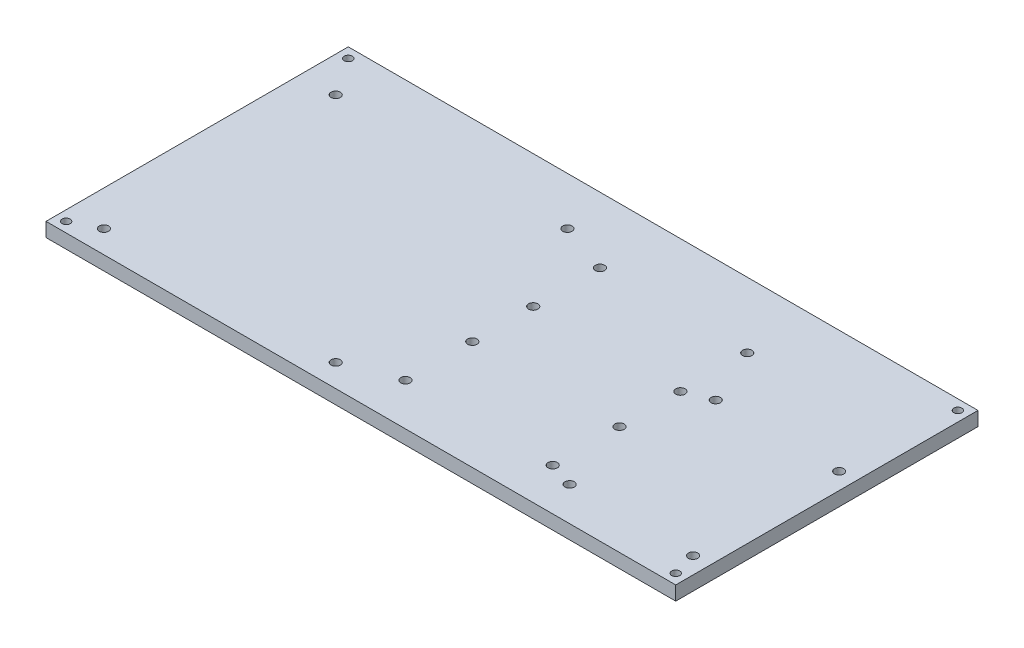
from build123d import *

# Parameters (mm, degrees)
SKETCH1_W                       = 250
SKETCH1_H                       = 120
BOSS_EXTRUDE1_DEPTH             = 5.588
F_3_0MM_CLEARANCE_DOWEL_HOLE2_D = 3.7
SKETCH6_R                       = 1.6
CUT_EXTRUDE1_DEPTH              = 139.766803465


with BuildPart() as part:
    # Sketch1 → Boss-Extrude1 (new body)
    with BuildSketch(Plane(origin=(0, 0, 0), x_dir=(1, 0, 0), z_dir=(0, 1, 0))):
        Rectangle(SKETCH1_W, SKETCH1_H)
    extrude(amount=BOSS_EXTRUDE1_DEPTH)

    # Ø3.0mm Clearance Dowel Hole2 (through all)
    with Locations(Plane(origin=(-44.960960081, 0, -163.688232646), x_dir=(-1, 0, 0), z_dir=(0, -1, 0))):
        with Locations((-45.935960081, -156.248232646), (-25.960960081, -122.688232646), (-45.935960081, -129.728232646), (-45.935960081, -180.428232646), (-45.935960081, -206.948232646), (-25.960960081, -214.688232646), (66.039039919, -214.688232646), (-104.385960081, -206.948232646), (-104.385960081, -180.428232646), (-104.385960081, -156.248232646), (-104.385960081, -129.728232646), (-163.338823355, -210.188232646), (-163.338823355, -152.188232646), (-114.338823355, -152.188232646), (-114.338823355, -210.188232646), (66.039039919, -122.688232646)):
            Hole(F_3_0MM_CLEARANCE_DOWEL_HOLE2_D / 2)

    # Sketch6 → Cut-Extrude1 (cut, through all)
    with BuildSketch(Plane(origin=(0, 5.588, 0), x_dir=(1, 0, 0), z_dir=(0, 1, 0))):
        with Locations((-121, 56)):
            Circle(SKETCH6_R)
        with Locations((-121, -56)):
            Circle(SKETCH6_R)
        with Locations((121, -56)):
            Circle(SKETCH6_R)
        with Locations((121, 56)):
            Circle(SKETCH6_R)
    extrude(amount=-CUT_EXTRUDE1_DEPTH, mode=Mode.SUBTRACT)


solid = part.part
